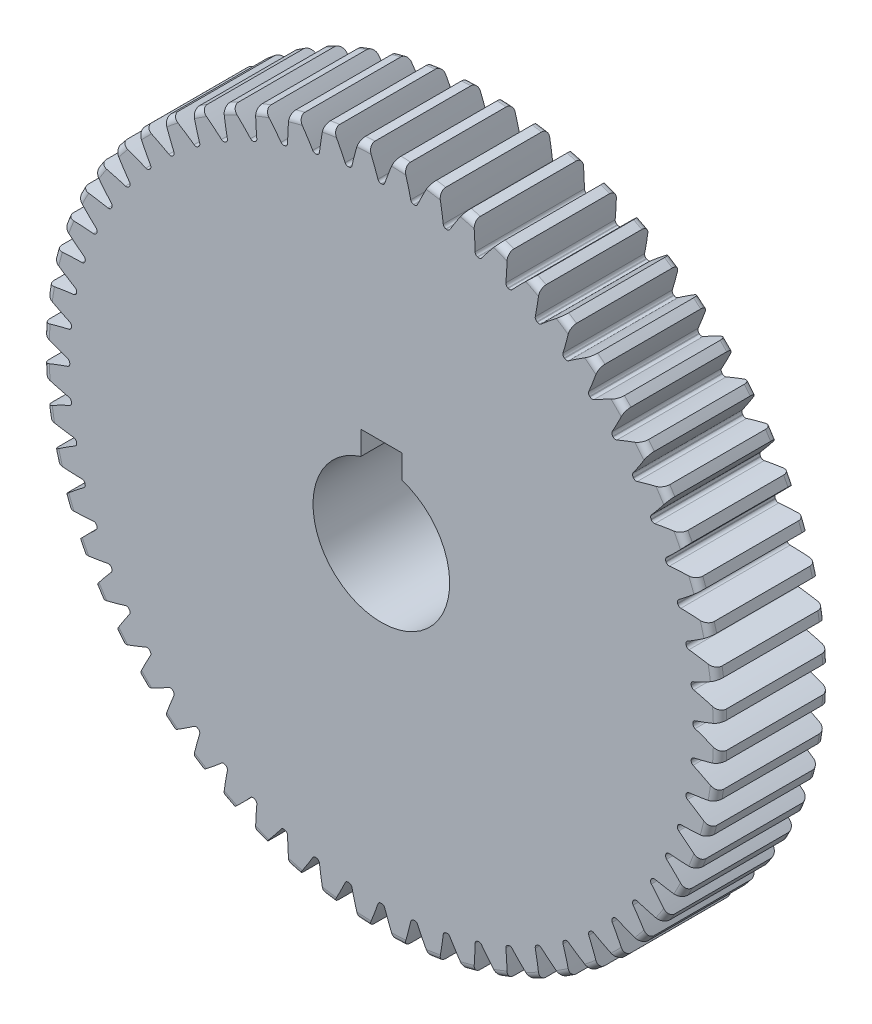
from build123d import *

# Parameters (mm, degrees)
FILLET2_R          = 0.7874
CUT_EXTRUDE2_DEPTH = 58.107651114
CIRPATTERN1_COUNT  = 60
CUT_EXTRUDE3_REACH = 63.16
SKETCH8_R          = 7.9375
SKETCH9_R          = 29.21
CUT_EXTRUDE4_DEPTH = 12.7
CUT_EXTRUDE5_REACH = 59.067


with BuildPart() as part:
    # Sketch4 → Revolve1 (revolve)
    with BuildSketch(Plane(origin=(0, 0, 0), x_dir=(0, 0, -1), z_dir=(1, 0, 0))):
        Polygon((-25.4, 6.35), (-25.4, 26.924), (-12.7, 26.924), (-12.7, 39.37), (0, 39.37), (0, 6.35), align=None)
    revolve(axis=Axis((0, 0, 12.7), (0, 0, 1)))

    # Fillet2
    fillet2_edges = [part.edges().sort_by_distance(p)[0] for p in [
        (0, -39.37, 0),
        (0, -39.37, 12.7),
        (0, -26.924, 12.7),
        (0, -26.924, 25.4),
    ]]
    fillet(fillet2_edges, radius=FILLET2_R)

    # Sketch7 → Cut-Extrude2 (cut, through all)
    with BuildSketch(Plane.XY.offset(12.7)):
        with BuildLine():
            ThreePointArc((-0.035463673, 36.194982626), (0, 36.195), (0.035463673, 36.194982626))
            ThreePointArc((0.035463673, 36.194982626), (0.25727039, 36.265930527), (0.396362136, 36.452706624))
            ThreePointArc((0.396362136, 36.452706624), (0.927423058, 37.908127348), (1.517215293, 39.340754413))
            ThreePointArc((1.517215293, 39.340754413), (0, 39.37), (-1.517215293, 39.340754413))
            ThreePointArc((-1.517215293, 39.340754413), (-0.927423058, 37.908127348), (-0.396362136, 36.452706624))
            ThreePointArc((-0.396362136, 36.452706624), (-0.25727039, 36.265930527), (-0.035463673, 36.194982626))
        make_face()
    cut_extrude2 = extrude(amount=-CUT_EXTRUDE2_DEPTH, mode=Mode.SUBTRACT)

    # CirPattern1: Cut-Extrude2 ×60 about axis
    cirpattern1_axis = Axis((0, 0, 0), (0, 0, 1))
    for i in range(1, CIRPATTERN1_COUNT):
        add(cut_extrude2.rotate(cirpattern1_axis, i * 360 / CIRPATTERN1_COUNT), mode=Mode.SUBTRACT)

    # Sketch8 → Cut-Extrude3 (cut, up to next)
    with BuildSketch(Plane(origin=(0, 0, 0), x_dir=(-1, 0, 0), z_dir=(0, 0, -1)), mode=Mode.PRIVATE) as cut_extrude3_sk1:
        with Locations(Location((0, 0, 0), (0, 0, 90))):
            Circle(SKETCH8_R)
    cut_extrude3_tool1 = extrude(cut_extrude3_sk1.sketch, amount=-CUT_EXTRUDE3_REACH, mode=Mode.PRIVATE) & part.part
    add(cut_extrude3_tool1.solids().sort_by_distance((0, 0, 0))[0], mode=Mode.SUBTRACT)

    # Sketch9 → Cut-Extrude4 (cut)
    with BuildSketch(Plane.XY.offset(25.4)):
        Circle(SKETCH9_R)
    extrude(amount=-CUT_EXTRUDE4_DEPTH, mode=Mode.SUBTRACT)

    # Sketch10 → Cut-Extrude5 (cut, up to next)
    with BuildSketch(Plane.XY.offset(12.7), mode=Mode.PRIVATE) as cut_extrude5_sk1:
        with BuildLine():
            Line((2.38125, 10.31875), (-2.38125, 10.31875))
            Line((-2.38125, 10.31875), (-2.38125, 7.571892411))
            ThreePointArc((-2.38125, 7.571892411), (0, 7.9375), (2.38125, 7.571892411))
            Line((2.38125, 7.571892411), (2.38125, 10.31875))
        make_face()
    cut_extrude5_tool1 = extrude(cut_extrude5_sk1.sketch, amount=-CUT_EXTRUDE5_REACH, mode=Mode.PRIVATE) & part.part
    add(cut_extrude5_tool1.solids().sort_by_distance((0, 9.065405, 12.7))[0], mode=Mode.SUBTRACT)


solid = part.part
